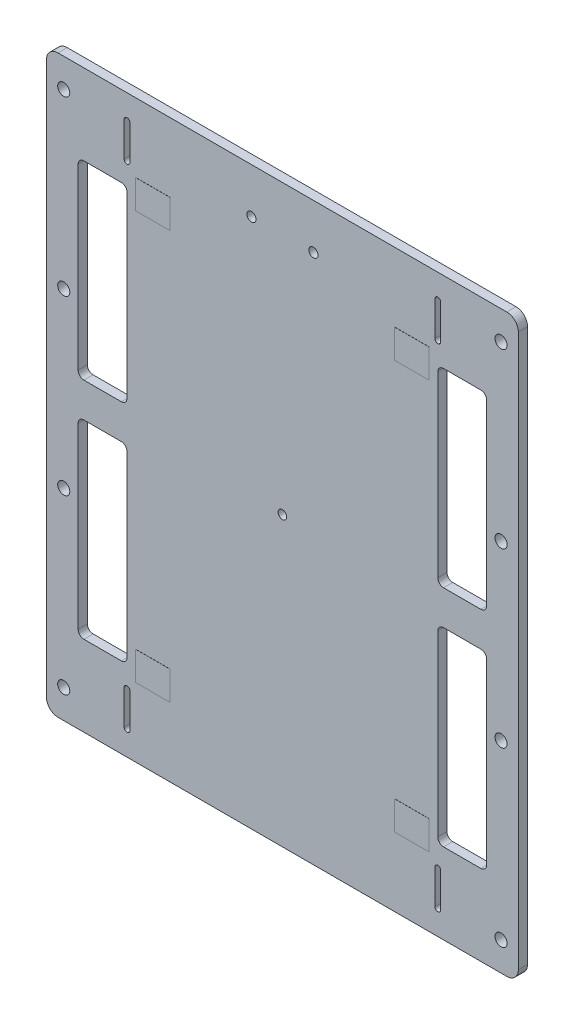
from build123d import *

# Parameters (mm, degrees)
BOSS_EXTRUDE1_DEPTH  = 1.6
SKETCH2_R            = 0.75
SKETCH2_R_2          = 0.8
CUT_EXTRUDE1_DEPTH   = 65.680445267
CUT_EXTRUDE3_DEPTH   = 1.6
CUT_EXTRUDE2_DEPTH   = 65.680445267
SKETCH5_W            = 6
SKETCH5_H            = 5
BOSS_EXTRUDE2_DEPTH  = 0.02
M2_CLEARANCE_HOLE1_D = 2.1


with BuildPart() as part:
    # Sketch1 → Boss-Extrude1 (new body)
    with BuildSketch(Plane.XY):
        with BuildLine():
            Line((-39, -50), (39, -50))
            ThreePointArc((39, -50), (40.414213562, -49.414213562), (41, -48))
            Line((41, -48), (41, 48))
            ThreePointArc((41, 48), (40.414213562, 49.414213562), (39, 50))
            Line((39, 50), (-39, 50))
            ThreePointArc((-39, 50), (-40.414213562, 49.414213562), (-41, 48))
            Line((-41, 48), (-41, -48))
            ThreePointArc((-41, -48), (-40.414213562, -49.414213562), (-39, -50))
        make_face()
    extrude(amount=BOSS_EXTRUDE1_DEPTH)

    # Sketch2 → Cut-Extrude1 (cut, through all)
    with BuildSketch(Plane.XY.offset(1.6)):
        Circle(SKETCH2_R)
        with Locations((-5.38, 42.15)):
            Circle(SKETCH2_R_2)
        with Locations((5.39, 42.15)):
            Circle(SKETCH2_R_2)
    extrude(amount=-CUT_EXTRUDE1_DEPTH, mode=Mode.SUBTRACT)

    # Sketch4 → Cut-Extrude3 (cut)
    with BuildSketch(Plane.XY.offset(1.6)):
        with BuildLine():
            Line((-27.5, 39.75), (-27.5, 45.75))
            ThreePointArc((-27.5, 45.75), (-27, 46.25), (-26.5, 45.75))
            Line((-26.5, 45.75), (-26.5, 39.75))
            ThreePointArc((-26.5, 39.75), (-27, 39.25), (-27.5, 39.75))
        make_face()
        with BuildLine():
            Line((26.5, 39.75), (26.5, 45.75))
            ThreePointArc((26.5, 45.75), (27, 46.25), (27.5, 45.75))
            Line((27.5, 45.75), (27.5, 39.75))
            ThreePointArc((27.5, 39.75), (27, 39.25), (26.5, 39.75))
        make_face()
        with BuildLine():
            Line((26.5, -45.75), (26.5, -39.75))
            ThreePointArc((26.5, -39.75), (27, -39.25), (27.5, -39.75))
            Line((27.5, -39.75), (27.5, -45.75))
            ThreePointArc((27.5, -45.75), (27, -46.25), (26.5, -45.75))
        make_face()
        with BuildLine():
            Line((-27.5, -45.75), (-27.5, -39.75))
            ThreePointArc((-27.5, -39.75), (-27, -39.25), (-26.5, -39.75))
            Line((-26.5, -39.75), (-26.5, -45.75))
            ThreePointArc((-26.5, -45.75), (-27, -46.25), (-27.5, -45.75))
        make_face()
    extrude(amount=-CUT_EXTRUDE3_DEPTH, mode=Mode.SUBTRACT)

    # Sketch3 → Cut-Extrude2 (cut, through all)
    with BuildSketch(Plane.XY.offset(1.6)):
        with BuildLine():
            Line((-34.5, 36), (-28, 36))
            ThreePointArc((-28, 36), (-27.292893219, 35.707106781), (-27, 35))
            Line((-27, 35), (-27, 4))
            ThreePointArc((-27, 4), (-27.292893219, 3.292893219), (-28, 3))
            Line((-28, 3), (-34.5, 3))
            ThreePointArc((-34.5, 3), (-35.207106781, 3.292893219), (-35.5, 4))
            Line((-35.5, 4), (-35.5, 35))
            ThreePointArc((-35.5, 35), (-35.207106781, 35.707106781), (-34.5, 36))
        make_face()
        with BuildLine():
            Line((-34.5, -36), (-28, -36))
            ThreePointArc((-28, -36), (-27.292893219, -35.707106781), (-27, -35))
            Line((-27, -35), (-27, -4))
            ThreePointArc((-27, -4), (-27.292893219, -3.292893219), (-28, -3))
            Line((-28, -3), (-34.5, -3))
            ThreePointArc((-34.5, -3), (-35.207106781, -3.292893219), (-35.5, -4))
            Line((-35.5, -4), (-35.5, -35))
            ThreePointArc((-35.5, -35), (-35.207106781, -35.707106781), (-34.5, -36))
        make_face()
        with BuildLine():
            Line((34.5, -36), (28, -36))
            ThreePointArc((28, -36), (27.292893219, -35.707106781), (27, -35))
            Line((27, -35), (27, -4))
            ThreePointArc((27, -4), (27.292893219, -3.292893219), (28, -3))
            Line((28, -3), (34.5, -3))
            ThreePointArc((34.5, -3), (35.207106781, -3.292893219), (35.5, -4))
            Line((35.5, -4), (35.5, -35))
            ThreePointArc((35.5, -35), (35.207106781, -35.707106781), (34.5, -36))
        make_face()
        with BuildLine():
            Line((34.5, 36), (28, 36))
            ThreePointArc((28, 36), (27.292893219, 35.707106781), (27, 35))
            Line((27, 35), (27, 4))
            ThreePointArc((27, 4), (27.292893219, 3.292893219), (28, 3))
            Line((28, 3), (34.5, 3))
            ThreePointArc((34.5, 3), (35.207106781, 3.292893219), (35.5, 4))
            Line((35.5, 4), (35.5, 35))
            ThreePointArc((35.5, 35), (35.207106781, 35.707106781), (34.5, 36))
        make_face()
    extrude(amount=-CUT_EXTRUDE2_DEPTH, mode=Mode.SUBTRACT)

    # Sketch5 → Boss-Extrude2 (add)
    with BuildSketch(Plane.XY.offset(1.6)):
        with Locations((-22.5, 35.5)):
            Rectangle(SKETCH5_W, SKETCH5_H)
        with Locations((22.5, 35.5)):
            Rectangle(SKETCH5_W, SKETCH5_H)
        with Locations((22.5, -35.5)):
            Rectangle(SKETCH5_W, SKETCH5_H)
        with Locations((-22.5, -35.5)):
            Rectangle(SKETCH5_W, SKETCH5_H)
    extrude(amount=BOSS_EXTRUDE2_DEPTH)

    # M2 Clearance Hole1 (through all)
    with Locations(Plane(origin=(0, 0, 0), x_dir=(-1, 0, 0), z_dir=(0, 0, -1))):
        with Locations((-38, 45), (-38, -15), (-38, -45), (-38, 15), (38, -45), (38, -15), (38, 15), (38, 45)):
            Hole(M2_CLEARANCE_HOLE1_D / 2)


solid = part.part
